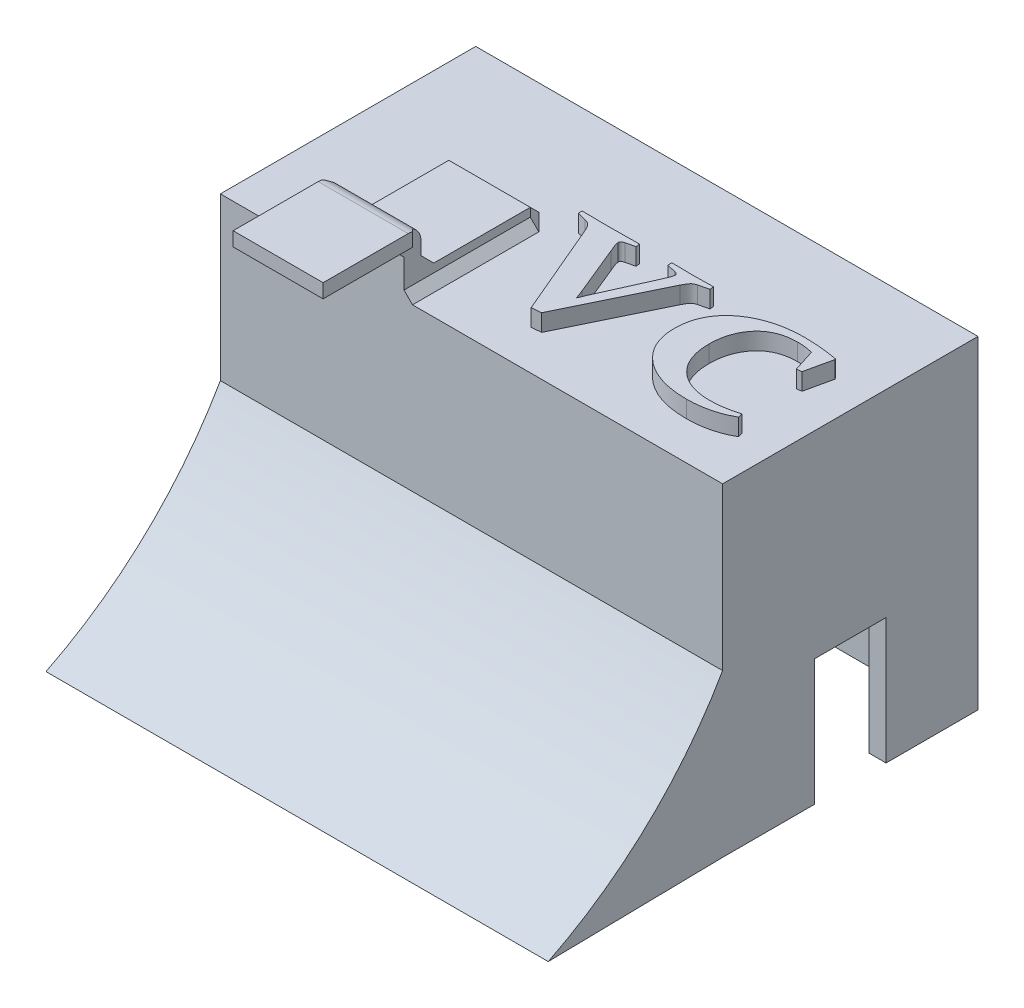
from build123d import *
from build123d.topology import SkipClean

# Parameters (mm, degrees)
BOSS_EXTRUDE1_DEPTH  = 8
SKETCH2_W            = 9.571982136
SKETCH2_H            = 10
BOSS_EXTRUDE2_DEPTH  = 2
BOSS_EXTRUDE3_DEPTH  = 9.571982
FILLET1_R            = 2
FILLET2_R            = 4
FILLET3_R            = 2
SKETCH4_W            = 9.571982136
SKETCH4_H            = 1.647948381
BOSS_EXTRUDE4_DEPTH  = 6
CUT_EXTRUDE1_DEPTH   = 39.95699317
CUT_EXTRUDE2_DEPTH   = 10
BOSS_EXTRUDE6_DEPTH  = 2
SKETCH10_W           = 59
SKETCH10_H           = 30
SKETCH10_W_2         = 55
SKETCH10_H_2         = 26
BOSS_EXTRUDE7_DEPTH  = 38
SKETCH11_W           = 8.4
SKETCH11_H           = 10.8
CUT_EXTRUDE3_DEPTH   = 38
BOSS_EXTRUDE8_DEPTH  = 59
SKETCH14_W           = 1
SKETCH14_H           = 10
BOSS_EXTRUDE9_DEPTH  = 1.647948381
CHAMFER1_SIZE        = 1
CHAMFER2_SIZE        = 1
BOSS_EXTRUDE10_DEPTH = 2
CHAMFER4_SIZE        = 1
SKETCH16_W           = 8.4
SKETCH16_H           = 4
CUT_EXTRUDE4_DEPTH   = 10
CUT_EXTRUDE5_DEPTH   = 2
SKETCH18_W           = 59
SKETCH18_H           = 5.292230066
CUT_EXTRUDE6_DEPTH   = 10
SKETCH20_W           = 55
SKETCH20_H           = 2
BOSS_EXTRUDE11_DEPTH = 36
SKETCH21_W           = 55
SKETCH21_H           = 2
CUT_EXTRUDE7_DEPTH   = 36
SKETCH22_W           = 2
SKETCH22_H           = 14.8
CUT_EXTRUDE8_DEPTH   = 10
SKETCH23_W           = 2
SKETCH23_H           = 14.8
BOSS_EXTRUDE12_DEPTH = 2
SKETCH24_W           = 59
SKETCH24_H           = 2
BOSS_EXTRUDE13_DEPTH = 38
SKETCH26_W           = 59
SKETCH26_H           = 22
CUT_EXTRUDE12_DEPTH  = 31
BOSS_EXTRUDE14_DEPTH = 59
CHAMFER5_SIZE        = 1.5


# Some blends are built 0.0001 mm under size
with BuildPart() as part:
    # Sketch1 → Boss-Extrude1 (new body)
    with BuildSketch(Plane(origin=(0, 0, 0), x_dir=(1, 0, 0), z_dir=(0, 1, 0))):
        with BuildLine():
            Line((-4.785991068, -8.780335386), (-4.785991068, -20.052065634))
            Line((-4.785991068, -20.052065634), (4.785991068, -20.052065634))
            Line((4.785991068, -20.052065634), (4.785991068, -14.215987109))
            ThreePointArc((4.785991068, -14.215987109), (10.931257236, 10.271689989), (-13.891030007, 5.660325552))
            ThreePointArc((-13.891030007, 5.660325552), (-12.461541016, 2.832721051), (-9.365408089, 3.505585733))
            ThreePointArc((-9.365408089, 3.505585733), (9.370244872, 3.492636688), (-4.785991068, -8.780335386))
        make_face()
    extrude(amount=BOSS_EXTRUDE1_DEPTH)

    # Sketch2 → Boss-Extrude2 (add)
    with BuildSketch(Plane.XZ):
        with Locations((0, 25.052065634)):
            Rectangle(SKETCH2_W, SKETCH2_H)
    extrude(amount=-BOSS_EXTRUDE2_DEPTH)

    # Sketch3 → Boss-Extrude3 (add)
    with SkipClean():  # the faces are left unmerged after this step: merging them gives an invalid solid
        with BuildSketch(Plane.ZY.offset(4.785991068)):
            Polygon((28.052065634, 2), (30.052065634, 2), (30.052065634, 5.352051619), (34.052065634, 5.352051619), (34.052065634, 7), (28.052065634, 7), align=None)
        extrude(amount=-BOSS_EXTRUDE3_DEPTH)

    # Fillet1
    fillet1_edges = [part.edges().sort_by_distance(p)[0] for p in [
        (-6.8e-08, 7, 28.052065634),
    ]]
    fillet(fillet1_edges, radius=FILLET1_R)

    # Fillet2
    fillet2_edges = [part.edges().sort_by_distance(p)[0] for p in [
        (0, 8, 20.052065634),
    ]]
    fillet(fillet2_edges, radius=FILLET2_R)

    # Fillet3
    fillet3_edges = [part.edges().sort_by_distance(p)[0] for p in [
        (9.370244872, 8, -3.492636688),
        (10.931257236, 8, -10.271689989),
    ]]
    fillet(fillet3_edges, radius=FILLET3_R)

    # Sketch4 → Boss-Extrude4 (add)
    with BuildSketch(Plane.XY.offset(34.052065634)):
        with Locations((0, 6.17602581)):
            Rectangle(SKETCH4_W, SKETCH4_H)
    extrude(amount=BOSS_EXTRUDE4_DEPTH)

    # Sketch6 → Cut-Extrude1 (cut, through all)
    with BuildSketch(Plane.XY.offset(20.052065634)):
        Polygon((-4.785991068, 2), (34.690864662, 2), (34.248371205, 14.815863311), (-47.379626596, 25.196479782), (-35.001418599, 2), align=None)
    extrude(amount=-CUT_EXTRUDE1_DEPTH, mode=Mode.SUBTRACT)

    # Sketch7 → Cut-Extrude2 (cut)
    with BuildSketch(Plane(origin=(0, 2, 0), x_dir=(1, 0, 0), z_dir=(0, 1, 0))):
        Polygon((4.785991068, -14.215987109), (-4.785991068, -14.215987109), (-26.705735245, 1.440211056), (11.698145347, 31.374089965), (22.246124289, -7.803053383), (8.65582728, -15.365529328), align=None)
    extrude(amount=-CUT_EXTRUDE2_DEPTH, mode=Mode.SUBTRACT)

    # Sketch9 → Boss-Extrude6 (add)
    with BuildSketch(Plane.XZ):
        Polygon((-4.785991068, 30.052065634), (40.214008932, 30.052065634), (40.214008932, 4.052065634), (-4.785991068, 4.052065634), (-14.785991068, 4.052065634), (-14.785991068, 30.052065634), align=None)
    extrude(amount=BOSS_EXTRUDE6_DEPTH)

    # Sketch10 → Boss-Extrude7 (add)
    with BuildSketch(Plane(origin=(0, 0, 0), x_dir=(1, 0, 0), z_dir=(0, 1, 0))):
        with Locations((12.714008932, -17.052065634)):
            Rectangle(SKETCH10_W, SKETCH10_H)
        with Locations((12.714008932, -17.052065634)):
            Rectangle(SKETCH10_W_2, SKETCH10_H_2, mode=Mode.SUBTRACT)
    extrude(amount=-BOSS_EXTRUDE7_DEPTH)

    # Sketch11 → Cut-Extrude3 (cut)
    with BuildSketch(Plane(origin=(42.214008932, 0, 0), x_dir=(0, 0, -1), z_dir=(1, 0, 0))):
        with Locations((-17.052065634, -28.6)):
            Rectangle(SKETCH11_W, SKETCH11_H)
    extrude(amount=-CUT_EXTRUDE3_DEPTH, mode=Mode.SUBTRACT)

    # Sketch13 → Boss-Extrude8 (add)
    with BuildSketch(Plane(origin=(42.214008932, 0, 0), x_dir=(0, 0, -1), z_dir=(1, 0, 0))):
        with BuildLine():
            Line((-32.052065634, -38), (-52.052065634, -38))
            ThreePointArc((-52.052065634, -38), (-38.465420391, -20.887708023), (-32.052065634, 0))
            Line((-32.052065634, 0), (-32.052065634, -38))
        make_face()
    extrude(amount=-BOSS_EXTRUDE8_DEPTH)

    # Sketch14 → Boss-Extrude9 (add)
    with BuildSketch(Plane(origin=(0, 7, 0), x_dir=(1, 0, 0), z_dir=(0, 1, 0))):
        with Locations((-5.285991068, -35.052065634)):
            Rectangle(SKETCH14_W, SKETCH14_H)
        with Locations((5.285991068, -35.052065634)):
            Rectangle(SKETCH14_W, SKETCH14_H)
    extrude(amount=-BOSS_EXTRUDE9_DEPTH)

    # Chamfer1
    # the kernel refuses this chamfer: 1 mm, written as the material it adds along each edge
    with BuildSketch(Plane(origin=(-4.785991068, 9.571682988, 30.052065634), x_dir=(-0.9996219169112968, 0, 0.027495876610585623), z_dir=(0, -1, 0))) as chamfer1_piece_1_section:
        Polygon((CHAMFER1_SIZE * 0.999621916911, CHAMFER1_SIZE * 0.0274958766106), (-CHAMFER1_SIZE * 0.0274958766106, CHAMFER1_SIZE * 0.999621916911), (0, 0), align=None)
    chamfer1_piece_1 = extrude(amount=4.219631369, mode=Mode.PRIVATE)
    chamfer1_piece_1 = chamfer1_piece_1 & Plane(origin=(-5.122919893, 5, 30.052065634), x_dir=(0, 1, 0), z_dir=(1, 0, 0)) * Cylinder(2, 13, mode=Mode.PRIVATE)
    add(chamfer1_piece_1)
    with BuildSketch(Plane(origin=(4.785991068, 9.571682988, 30.052065634), x_dir=(-0.02749587661058651, 0, -0.9996219169112968), z_dir=(0, -1, 0))) as chamfer1_piece_2_section:
        Polygon((CHAMFER1_SIZE * 0.999621916911, CHAMFER1_SIZE * 0.0274958766106), (-CHAMFER1_SIZE * 0.0274958766106, CHAMFER1_SIZE * 0.999621916911), (0, 0), align=None)
    chamfer1_piece_2 = extrude(amount=4.219631369, mode=Mode.PRIVATE)
    chamfer1_piece_2 = chamfer1_piece_2 & Plane(origin=(5.122919893, 5, 30.052065634), x_dir=(0, 1, 0), z_dir=(1, 0, 0)) * Cylinder(2, 13, mode=Mode.PRIVATE)
    add(chamfer1_piece_2)

    # Chamfer2
    chamfer2_edges = [part.edges().sort_by_distance(p)[0] for p in [
        (4.785991068, 1, 14.215987109),
        (-4.785991068, 0, 22.134026372),
        (0, 0, 14.215987109),
        (0, 2, 14.215987109),
        (-4.785991068, 1, 14.215987109),
        (4.785991068, 0, 22.134026372),
    ]]
    chamfer(chamfer2_edges, length=CHAMFER2_SIZE - 0.0001)  # a hair under: the kernel refuses the full size

    # Sketch15 → Boss-Extrude10 (add)
    with BuildSketch(Plane(origin=(0, 0, 0), x_dir=(1, 0, 0), z_dir=(0, 1, 0))):
        with BuildLine():
            add(Edge.make_bspline(
                [(16.341341076, -20.716220618), (16.40847526, -20.88507901), (16.539756971, -21.215283639), (16.660848763, -21.549358274), (16.720017241, -21.712595492)],
                knots=[0, 0, 0, 0, 1.02275, 2, 2, 2, 2], degree=3))
            add(Edge.make_bspline(
                [(16.720017241, -21.712595492), (16.786988835, -21.550490796), (16.922904144, -21.221507889), (17.06091465, -20.893398381), (17.130921164, -20.726963205)],
                knots=[0, 0, 0, 0, 0.985490078, 2, 2, 2, 2], degree=3))
            Line((17.130921164, -20.726963205), (19.74136962, -14.907167111))
            add(Edge.make_bspline(
                [(19.74136962, -14.907167111), (19.775273191, -14.82654862), (19.83934335, -14.67419772), (19.931440543, -14.460062292), (20.008787038, -14.271436076), (20.076817756, -14.108065581), (20.136615491, -13.9668159), (20.172707857, -13.83925498), (20.200258703, -13.729315065), (20.20419371, -13.660260277), (20.205986475, -13.628799348)],
                knots=[0, 0, 0, 0, 1.536838615, 2.904280956, 4.09622762, 5.118758436, 6.015577289, 6.787050036, 7.447387596, 8, 8, 8, 8], degree=3))
            add(Edge.make_bspline(
                [(20.205986475, -13.628799348), (20.202755185, -13.582283974), (20.196533849, -13.492725985), (20.102624834, -13.382886665), (19.965517769, -13.308456785), (19.856066693, -13.281343879), (19.795082551, -13.266237063)],
                knots=[0, 0, 0, 0, 0.91002827, 1.752115377, 2.747519711, 4, 4, 4, 4], degree=3))
            Line((19.795082551, -13.266237063), (18.766479919, -13.021843226))
            Line((18.766479919, -13.021843226), (18.73425216, -12.541112492))
            add(Edge.make_bspline(
                [(18.73425216, -12.541112492), (18.983116155, -12.546766215), (19.457544982, -12.557544348), (20.132550438, -12.568496585), (20.73505181, -12.573557296), (21.111944062, -12.575238988), (21.288302038, -12.576025897)],
                knots=[0, 0, 0, 0, 1.169435038, 2.229385146, 3.1714819, 4, 4, 4, 4], degree=3))
            add(Edge.make_bspline(
                [(21.288302038, -12.576025897), (21.465555317, -12.575257516), (21.831705792, -12.573670279), (22.399297685, -12.568692797), (23.001800215, -12.557911141), (23.415341902, -12.546808469), (23.627500191, -12.541112492)],
                knots=[0, 0, 0, 0, 0.909182345, 1.878089647, 2.911401477, 4, 4, 4, 4], degree=3))
            Line((23.627500191, -12.541112492), (23.691955709, -13.0030437))
            Line((23.691955709, -13.0030437), (22.523699455, -13.285036589))
            add(Edge.make_bspline(
                [(22.523699455, -13.285036589), (22.46047007, -13.304075102), (22.340421588, -13.340221976), (22.176550127, -13.416335472), (22.03689772, -13.506713522), (21.922596026, -13.620586862), (21.820590493, -13.756428445), (21.717579978, -13.91869712), (21.60248673, -14.109165895), (21.532460589, -14.251253784), (21.495096823, -14.327067454)],
                knots=[0, 0, 0, 0, 1.038698084, 1.97209139, 2.83616354, 3.643644935, 4.498002902, 5.506806906, 6.669709862, 8, 8, 8, 8], degree=3))
            Line((21.495096823, -14.327067454), (16.180202282, -25.276448476))
            Line((16.180202282, -25.276448476), (15.041488141, -25.367760459))
            Line((15.041488141, -25.367760459), (10.39800524, -14.434493316))
            add(Edge.make_bspline(
                [(10.39800524, -14.434493316), (10.355426143, -14.338075292), (10.276751918, -14.159921839), (10.149751089, -13.922511971), (10.03280643, -13.732119495), (9.910639696, -13.589957141), (9.782959485, -13.476744547), (9.632707506, -13.390558225), (9.462042443, -13.313678012), (9.337731466, -13.277237681), (9.272719332, -13.258180123)],
                knots=[0, 0, 0, 0, 1.483056893, 2.740272973, 3.788952559, 4.620003468, 5.370419823, 6.178705846, 7.047499884, 8, 8, 8, 8], degree=3))
            Line((9.272719332, -13.258180123), (8.222631527, -13.0030437))
            Line((8.222631527, -13.0030437), (8.176975536, -12.541112492))
            add(Edge.make_bspline(
                [(8.176975536, -12.541112492), (8.668430298, -12.551631492), (9.650370631, -12.572648749), (10.632533221, -12.574900922), (11.123129811, -12.576025897)],
                knots=[0, 0, 0, 0, 1.000987017, 2, 2, 2, 2], degree=3))
            add(Edge.make_bspline(
                [(11.123129811, -12.576025897), (11.768595373, -12.574988886), (13.042575321, -12.572942099), (14.316377956, -12.551627827), (14.944804865, -12.541112492)],
                knots=[0, 0, 0, 0, 1.013305685, 2, 2, 2, 2], degree=3))
            Line((14.944804865, -12.541112492), (14.998517796, -13.0030437))
            Line((14.998517796, -13.0030437), (13.937687405, -13.258180123))
            add(Edge.make_bspline(
                [(13.937687405, -13.258180123), (13.874188184, -13.276221545), (13.76354112, -13.30765863), (13.623728706, -13.381807171), (13.535576443, -13.496954999), (13.529866538, -13.58780302), (13.526783482, -13.636856288)],
                knots=[0, 0, 0, 0, 1.292930384, 2.252924518, 3.056668923, 4, 4, 4, 4], degree=3))
            add(Edge.make_bspline(
                [(13.526783482, -13.636856288), (13.5334685, -13.707112366), (13.549028778, -13.870642832), (13.619569767, -14.08135692), (13.699210561, -14.28149691), (13.772247224, -14.464876143), (13.853820618, -14.67359562), (13.91580929, -14.819594556), (13.948429992, -14.896424524)],
                knots=[0, 0, 0, 0, 0.949938851, 2.211110381, 2.976060463, 3.859871725, 4.873786398, 6, 6, 6, 6], degree=3))
            Line((13.948429992, -14.896424524), (16.341341076, -20.716220618))
        make_face()
        with BuildLine():
            Line((37.464488394, -15.967997501), (36.870960505, -16.048566898))
            Line((36.870960505, -16.048566898), (36.046467011, -13.446175382))
            add(Edge.make_bspline(
                [(36.046467011, -13.446175382), (35.901903287, -13.410753439), (35.608585465, -13.338882799), (35.152840737, -13.272616054), (34.680407494, -13.227131331), (34.359101732, -13.22278606), (34.196056532, -13.220581071)],
                knots=[0, 0, 0, 0, 0.955071831, 1.937827695, 2.953559702, 4, 4, 4, 4], degree=3))
            add(Edge.make_bspline(
                [(34.196056532, -13.220581071), (34.002478023, -13.225225919), (33.62475625, -13.23428922), (33.074208733, -13.304757116), (32.557551481, -13.421719407), (32.075005314, -13.586666234), (31.625480707, -13.7966087), (31.209213694, -14.055537196), (30.828572853, -14.364051556), (30.485180302, -14.716978481), (30.179339927, -15.106690578), (29.913310834, -15.527409937), (29.68449766, -15.975907615), (29.504679051, -16.456380715), (29.357360676, -16.963048137), (29.256593984, -17.49995176), (29.1976885, -18.065951479), (29.189056068, -18.452973194), (29.184640052, -18.650958414)],
                knots=[0, 0, 0, 0, 1.111280399, 2.168395678, 3.180928479, 4.148149079, 5.090952678, 6.023782221, 6.955832475, 7.897303885, 8.845431456, 9.795174047, 10.751501418, 11.730978777, 12.736440915, 13.77785481, 14.863237156, 16, 16, 16, 16], degree=3))
            add(Edge.make_bspline(
                [(29.184640052, -18.650958414), (29.189036185, -18.861558501), (29.197631355, -19.273316647), (29.271940383, -19.874496096), (29.390786235, -20.443284011), (29.562388268, -20.978509275), (29.775055933, -21.483914494), (30.04352998, -21.95263357), (30.357823917, -22.389845626), (30.718932981, -22.790631381), (31.123467502, -23.15260869), (31.567277579, -23.467725604), (32.051045146, -23.73237219), (32.56995369, -23.950625143), (33.127978251, -24.11591473), (33.720920771, -24.23652186), (34.351768541, -24.310055723), (34.784906667, -24.318639941), (35.007121792, -24.323043947)],
                knots=[0, 0, 0, 0, 1.098145431, 2.147056698, 3.154486784, 4.124728287, 5.074482538, 6.009288204, 6.935894074, 7.878226815, 8.817442214, 9.761959052, 10.710783043, 11.688156096, 12.692703439, 13.741271651, 14.841192741, 16, 16, 16, 16], degree=3))
            add(Edge.make_bspline(
                [(35.007121792, -24.323043947), (35.265240886, -24.316657208), (35.790372219, -24.303663683), (36.586468634, -24.201251325), (37.40373908, -24.042033285), (37.947124236, -23.886699071), (38.224526371, -23.807399808)],
                knots=[0, 0, 0, 0, 0.947054205, 1.926737886, 2.941584381, 4, 4, 4, 4], degree=3))
            Line((38.224526371, -23.807399808), (38.364179992, -24.323043947))
            add(Edge.make_bspline(
                [(38.364179992, -24.323043947), (38.182046852, -24.422500452), (37.818663031, -24.620931582), (37.24816322, -24.869161081), (36.662904447, -25.082502692), (36.057753513, -25.254548585), (35.435881714, -25.388075513), (34.796435433, -25.484499293), (34.139972994, -25.54599914), (33.695768643, -25.552476941), (33.470931961, -25.555755718)],
                knots=[0, 0, 0, 0, 0.975480671, 1.946235011, 2.922405863, 3.903168525, 4.902300265, 5.911501367, 6.942893955, 8, 8, 8, 8], degree=3))
            add(Edge.make_bspline(
                [(33.470931961, -25.555755718), (33.182408315, -25.551506022), (32.619226007, -25.543210848), (31.796767441, -25.452112382), (31.014357859, -25.319737092), (30.275436993, -25.122338169), (29.576417962, -24.873609933), (28.923597667, -24.562377351), (28.30831479, -24.202823898), (27.744308258, -23.784413589), (27.234138786, -23.321762541), (26.787898043, -22.819694475), (26.40737969, -22.282490052), (26.101402338, -21.706523927), (25.858583817, -21.097432266), (25.691699672, -20.451273447), (25.586533164, -19.770735326), (25.573646935, -19.30485984), (25.567074137, -19.067233631)],
                knots=[0, 0, 0, 0, 1.205249911, 2.352581621, 3.454181702, 4.518645907, 5.544671896, 6.550451794, 7.536634623, 8.518350816, 9.479695802, 10.409903477, 11.320186467, 12.224019377, 13.129252673, 14.053944392, 15.007387528, 16, 16, 16, 16], degree=3))
            add(Edge.make_bspline(
                [(25.567074137, -19.067233631), (25.568051902, -18.939142431), (25.569982844, -18.686181214), (25.602452059, -18.312673348), (25.645629505, -17.948158949), (25.714530324, -17.594572561), (25.796844075, -17.249904013), (25.898296486, -16.915580729), (26.023266321, -16.593816609), (26.16294518, -16.280422695), (26.321227692, -15.976986346), (26.498905219, -15.683719104), (26.69525865, -15.401087165), (26.911508665, -15.129284745), (27.144732201, -14.86583379), (27.397884008, -14.613204542), (27.669590226, -14.371115611), (28.057755085, -14.063278697), (28.57707529, -13.70727771), (29.248190538, -13.339965719), (29.963517063, -13.0270457), (30.724054289, -12.772197274), (31.530725849, -12.573710781), (32.382710602, -12.432507648), (33.280373718, -12.349073253), (33.893295496, -12.337534184), (34.206799118, -12.33163206)],
                knots=[0, 0, 0, 0, 0.748887641, 1.478942585, 2.191361113, 2.894776152, 3.584336418, 4.263380662, 4.936260497, 5.601848913, 6.269288189, 6.936460435, 7.60603211, 8.28064122, 8.966773989, 9.662803939, 10.371112494, 11.09395973, 12.559289181, 14.047313805, 15.561915739, 17.119949654, 18.732694076, 20.415488379, 22.166556617, 24, 24, 24, 24], degree=3))
            add(Edge.make_bspline(
                [(34.206799118, -12.33163206), (34.526522571, -12.336491896), (35.170286299, -12.346277183), (36.139790168, -12.419756876), (37.120750998, -12.532292307), (37.77383386, -12.647002659), (38.103672275, -12.704936932)],
                knots=[0, 0, 0, 0, 0.978669418, 1.970552568, 2.975030944, 4, 4, 4, 4], degree=3))
            Line((38.103672275, -12.704936932), (38.168127793, -12.793563268))
            Line((38.168127793, -12.793563268), (37.464488394, -15.967997501))
        make_face()
    extrude(amount=BOSS_EXTRUDE10_DEPTH)

    # Chamfer4
    chamfer4_edges = [part.edges().sort_by_distance(p)[0] for p in [
        (-6.8e-08, 5.352051619, 30.052065634),
    ]]
    chamfer(chamfer4_edges, length=CHAMFER4_SIZE)

    # Sketch16 → Cut-Extrude4 (cut)
    with BuildSketch(Plane(origin=(42.214008932, 0, 0), x_dir=(0, 0, -1), z_dir=(1, 0, 0))):
        with Locations((-17.052065634, -36)):
            Rectangle(SKETCH16_W, SKETCH16_H)
    extrude(amount=-CUT_EXTRUDE4_DEPTH, mode=Mode.SUBTRACT)

    # Sketch17 → Cut-Extrude5 (cut)
    with BuildSketch(Plane(origin=(0, 7, 0), x_dir=(1, 0, 0), z_dir=(0, 1, 0))):
        Polygon((-5.285991068, -30.552065634), (-5.285991068, -27.107560215), (-11.195326609, -28.180579827), (-7.629510094, -44.440581197), (-5.285991068, -41.39368974), (-5.285991068, -39.552065634), align=None)
        Polygon((5.285991068, -39.552065634), (5.285991068, -30.552065634), (5.285991068, -27.107560215), (12.96043872, -35.42314432), (6.254968556, -43.07612738), (5.285991068, -41.013200382), align=None)
    extrude(amount=-CUT_EXTRUDE5_DEPTH, mode=Mode.SUBTRACT)

    # Sketch18 → Cut-Extrude6 (cut)
    with BuildSketch(Plane(origin=(0, 0, 0), x_dir=(1, 0, 0), z_dir=(0, 1, 0))):
        with Locations((12.714008932, -34.698180667)):
            Rectangle(SKETCH18_W, SKETCH18_H)
        Polygon((5.785991068, -30.052065634), (-5.785991068, -30.052065634), (-16.785991068, -30.052065634), (-16.785991068, -32.052065634), (42.214008932, -32.052065634), (42.214008932, -30.052065634), align=None)
    extrude(amount=-CUT_EXTRUDE6_DEPTH, mode=Mode.SUBTRACT)

    # Sketch20 → Boss-Extrude11 (add)
    with BuildSketch(Plane.XZ.offset(2)):
        with Locations((12.714008932, 29.052065634)):
            Rectangle(SKETCH20_W, SKETCH20_H)
    extrude(amount=BOSS_EXTRUDE11_DEPTH)

    # Sketch21 → Cut-Extrude7 (cut)
    with BuildSketch(Plane.XZ.offset(38)):
        with Locations((12.714008932, 3.052065634)):
            Rectangle(SKETCH21_W, SKETCH21_H)
    extrude(amount=-CUT_EXTRUDE7_DEPTH, mode=Mode.SUBTRACT)

    # Sketch22 → Cut-Extrude8 (cut)
    with BuildSketch(Plane(origin=(42.214008932, 0, 0), x_dir=(0, 0, -1), z_dir=(1, 0, 0))):
        with Locations((-11.852065634, -30.6)):
            Rectangle(SKETCH22_W, SKETCH22_H)
    extrude(amount=-CUT_EXTRUDE8_DEPTH, mode=Mode.SUBTRACT)

    # Sketch23 → Boss-Extrude12 (add)
    with BuildSketch(Plane(origin=(42.214008932, 0, 0), x_dir=(0, 0, -1), z_dir=(1, 0, 0))):
        with Locations((-20.252065634, -30.6)):
            Rectangle(SKETCH23_W, SKETCH23_H)
    extrude(amount=-BOSS_EXTRUDE12_DEPTH)

    # Sketch24 → Boss-Extrude13 (add)
    with BuildSketch(Plane(origin=(0, 0, 0), x_dir=(1, 0, 0), z_dir=(0, 1, 0))):
        with Locations((12.714008932, -1.052065634)):
            Rectangle(SKETCH24_W, SKETCH24_H)
    extrude(amount=-BOSS_EXTRUDE13_DEPTH)

    # Sketch26 → Cut-Extrude12 (cut)
    with BuildSketch(Plane.XZ.offset(38)):
        with Locations((12.714008932, 41.052065634)):
            Rectangle(SKETCH26_W, SKETCH26_H)
    extrude(amount=-CUT_EXTRUDE12_DEPTH, mode=Mode.SUBTRACT)

    # Sketch27 → Boss-Extrude14 (add)
    with BuildSketch(Plane(origin=(42.214008932, 0, 0), x_dir=(0, 0, -1), z_dir=(1, 0, 0))):
        with BuildLine():
            Line((-30.052065634, -38), (-50.53307042, -38.36078482))
            ThreePointArc((-50.53307042, -38.36078482), (-38.85744832, -30.19854851), (-30.052065634, -19))
            Line((-30.052065634, -19), (-30.052065634, -38))
        make_face()
    extrude(amount=-BOSS_EXTRUDE14_DEPTH)

    # Chamfer5
    chamfer5_edges = [part.edges().sort_by_distance(p)[0] for p in [
        (-6.8e-08, 2, 28.052065634),
    ]]
    chamfer(chamfer5_edges, length=CHAMFER5_SIZE)


solid = part.part
